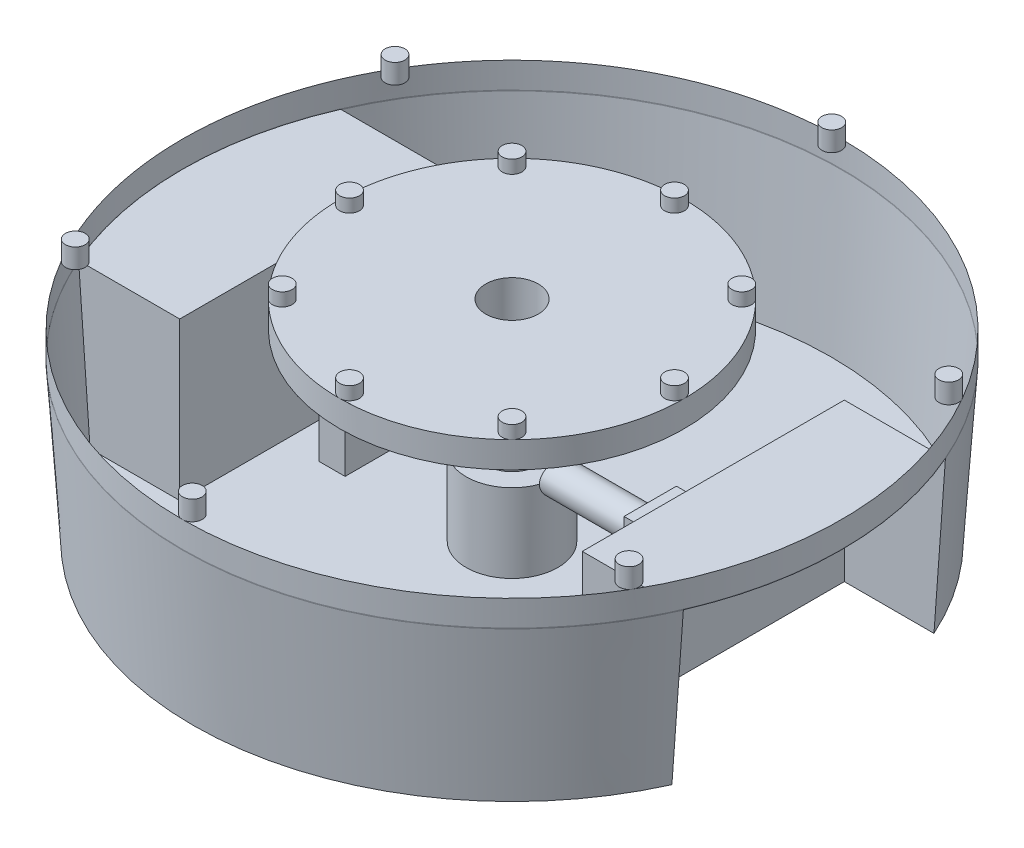
from build123d import *

# Parameters (mm, degrees)
SKETCH1_R           = 41.75125
BOSS_EXTRUDE1_DEPTH = 6.35
SKETCH2_R           = 2.38125
BOSS_EXTRUDE2_DEPTH = 3.175
SKETCH3_R           = 79.85125
BOSS_EXTRUDE3_DEPTH = 6.35
SKETCH4_R           = 2.38125
BOSS_EXTRUDE4_DEPTH = 4.7625
SKETCH5_R           = 77.31125
BOSS_EXTRUDE5_DEPTH = 38.1
FILLET1_R           = 2.54
CUT_EXTRUDE1_DEPTH  = 38.1
SKETCH8_R           = 3.81
CUT_EXTRUDE2_DEPTH  = 97.536
SKETCH9_R           = 6.35
CUT_EXTRUDE3_DEPTH  = 50.8
SKETCH10_R          = 11.1125
CUT_EXTRUDE4_DEPTH  = 19.05
SKETCH11_W          = 6.35
SKETCH11_H          = 12.7
CUT_EXTRUDE5_DEPTH  = 25.4
SKETCH12_R          = 11.1125
SKETCH12_R_2        = 6.35
BOSS_EXTRUDE6_DEPTH = 6.35


with BuildPart() as part:
    # Sketch1 → Boss-Extrude1 (new body)
    with BuildSketch(Plane(origin=(0, 0, 0), x_dir=(1, 0, 0), z_dir=(0, 1, 0))):
        with Locations(Location((0, 0, 0), (0, 0, 270))):
            Circle(SKETCH1_R)
    extrude(amount=BOSS_EXTRUDE1_DEPTH)

    # Sketch2 → Boss-Extrude2 (add)
    with BuildSketch(Plane(origin=(0, 6.35, 0), x_dir=(1, 0, 0), z_dir=(0, 1, 0))):
        with Locations(Location((0, 39.37, 0), (0, 0, 89.99945926))):
            Circle(SKETCH2_R)
        with Locations(Location((27.838793975, 27.838793975, 0), (0, 0, 44.999445214))):
            Circle(SKETCH2_R)
        with Locations(Location((39.37, 0, 0), (0, 0, 359.999429558))):
            Circle(SKETCH2_R)
        with Locations(Location((27.838793975, -27.838793975, 0), (0, 0, 314.999421479))):
            Circle(SKETCH2_R)
        with Locations(Location((0, -39.37, 0), (0, 0, 269.999424945))):
            Circle(SKETCH2_R)
        with Locations(Location((-27.838793975, -27.838793975, 0), (0, 0, 224.999438328))):
            Circle(SKETCH2_R)
        with Locations(Location((-39.37, 0, 0), (0, 0, 179.999453674))):
            Circle(SKETCH2_R)
        with Locations(Location((-27.838793975, 27.838793975, 0), (0, 0, 134.999462078))):
            Circle(SKETCH2_R)
    extrude(amount=BOSS_EXTRUDE2_DEPTH)

    # Sketch3 → Boss-Extrude3 (add)
    with BuildSketch(Plane.XZ):
        with Locations(Location((0, 0, 0), (0, 0, 270))):
            Circle(SKETCH3_R)
    extrude(amount=BOSS_EXTRUDE3_DEPTH)

    # Sketch4 → Boss-Extrude4 (add)
    with BuildSketch(Plane(origin=(0, 0, 0), x_dir=(1, 0, 0), z_dir=(0, 1, 0))):
        with Locations(Location((0, 77.47, 0), (0, 0, 89.999466901))):
            Circle(SKETCH4_R)
        with Locations(Location((67.090988031, 38.735, 0), (0, 0, 29.999456844))):
            Circle(SKETCH4_R)
        with Locations(Location((67.090988031, -38.735, 0), (0, 0, 329.999448342))):
            Circle(SKETCH4_R)
        with Locations(Location((0, -77.47, 0), (0, 0, 270))):
            Circle(SKETCH4_R)
        with Locations(Location((-67.090988031, -38.735, 0), (0, 0, 209.999457825))):
            Circle(SKETCH4_R)
        with Locations(Location((-67.090988031, 38.735, 0), (0, 0, 149.999465475))):
            Circle(SKETCH4_R)
    extrude(amount=BOSS_EXTRUDE4_DEPTH)

    # Sketch5 → Boss-Extrude5 (add)
    with BuildSketch(Plane.XZ.offset(6.35)):
        with Locations(Location((0, 0, 0), (0, 0, 90))):
            Circle(SKETCH5_R)
    extrude(amount=BOSS_EXTRUDE5_DEPTH)

    # Sketch6 → Revolve1 (revolve)
    with BuildSketch(Plane(origin=(0, 0, 0), x_dir=(0, 0, -1), z_dir=(1, 0, 0)), mode=Mode.PRIVATE) as revolve1_sk:
        Polygon((77.31125, -6.35), (77.31125, -44.45), (79.85125, -6.35), align=None)
    revolve(revolve1_sk.sketch.rotate(Axis((0, 12.22375, 0), (0, -1, 0)), 180), axis=Axis((0, 12.22375, 0), (0, -1, 0)))

    # Fillet1
    # the kernel refuses this fillet: 2.54 mm, written as the material it takes off along each edge
    with BuildSketch(Plane(origin=(0, -6.35, 0), x_dir=(0, 0, 1), z_dir=(1, 0, 0))) as fillet1_piece_1:
        with BuildLine():
            CenterArc((79.85125 - FILLET1_R, -FILLET1_R * 0.0332963783729), FILLET1_R, 0, 3.814074834)
            Line((79.85125 - FILLET1_R * 0.00221484214339, FILLET1_R * 0.0332226321509), (79.85125, 0))
            Line((79.85125, 0), (79.85125, -FILLET1_R * 0.0332963783729))
        make_face()
    revolve(axis=Axis((0, -6.35, 0), (0, -1, 0)), revolution_arc=180, mode=Mode.SUBTRACT)
    with BuildSketch(Plane(origin=(0, -6.35, 0), x_dir=(0, 0, -1), z_dir=(-1, 0, 0))) as fillet1_piece_2:
        with BuildLine():
            CenterArc((79.85125 - FILLET1_R, -FILLET1_R * 0.0332963783729), FILLET1_R, 0, 3.814074834)
            Line((79.85125 - FILLET1_R * 0.00221484214339, FILLET1_R * 0.0332226321509), (79.85125, 0))
            Line((79.85125, 0), (79.85125, -FILLET1_R * 0.0332963783729))
        make_face()
    revolve(axis=Axis((0, -6.35, 0), (0, -1, 0)), revolution_arc=180, mode=Mode.SUBTRACT)

    # Sketch7 → Cut-Extrude1 (cut)
    with BuildSketch(Plane.XZ.offset(44.45)):
        Polygon((48.768, -31.75), (48.768, 31.75), (70.490899246, 31.75), (86.685802419, 31.75), (86.685802419, -31.75), (70.490899246, -31.75), align=None)
        Polygon((-48.768, -31.75), (-48.768, 31.75), (-70.490899246, 31.75), (-86.531926913, 31.75), (-86.531926913, -31.75), (-70.490899246, -31.75), align=None)
    extrude(amount=-CUT_EXTRUDE1_DEPTH, mode=Mode.SUBTRACT)

    # Sketch8 → Cut-Extrude2 (cut)
    with BuildSketch(Plane.ZY.offset(48.768)):
        with Locations((0, -25.4)):
            Circle(SKETCH8_R)
    extrude(amount=-CUT_EXTRUDE2_DEPTH, mode=Mode.SUBTRACT)

    # Sketch9 → Cut-Extrude3 (cut)
    with BuildSketch(Plane(origin=(0, 6.35, 0), x_dir=(1, 0, 0), z_dir=(0, 1, 0))):
        with Locations(Location((0, 0, 0), (0, 0, 270))):
            Circle(SKETCH9_R)
    extrude(amount=-CUT_EXTRUDE3_DEPTH, mode=Mode.SUBTRACT)

    # Sketch10 → Cut-Extrude4 (cut)
    with BuildSketch(Plane.XZ.offset(44.45)):
        with Locations(Location((0, 0, 0), (0, 0, 270))):
            Circle(SKETCH10_R)
    extrude(amount=-CUT_EXTRUDE4_DEPTH, mode=Mode.SUBTRACT)

    # Sketch11 → Cut-Extrude5 (cut)
    with BuildSketch(Plane.XZ.offset(44.45)):
        with Locations((36.968003166, 0.307880226)):
            Rectangle(SKETCH11_W, SKETCH11_H)
        with Locations((-36.968003166, 0.307880226)):
            Rectangle(SKETCH11_W, SKETCH11_H)
    extrude(amount=-CUT_EXTRUDE5_DEPTH, mode=Mode.SUBTRACT)

    # Sketch12 → Boss-Extrude6 (add)
    with BuildSketch(Plane.XZ.offset(25.4)):
        with Locations(Location((0, 0, 0), (0, 0, 270))):
            Circle(SKETCH12_R)
        with Locations(Location((0, 0, 0), (0, 0, 90))):
            Circle(SKETCH12_R_2, mode=Mode.SUBTRACT)
    extrude(amount=-BOSS_EXTRUDE6_DEPTH)


solid = part.part
